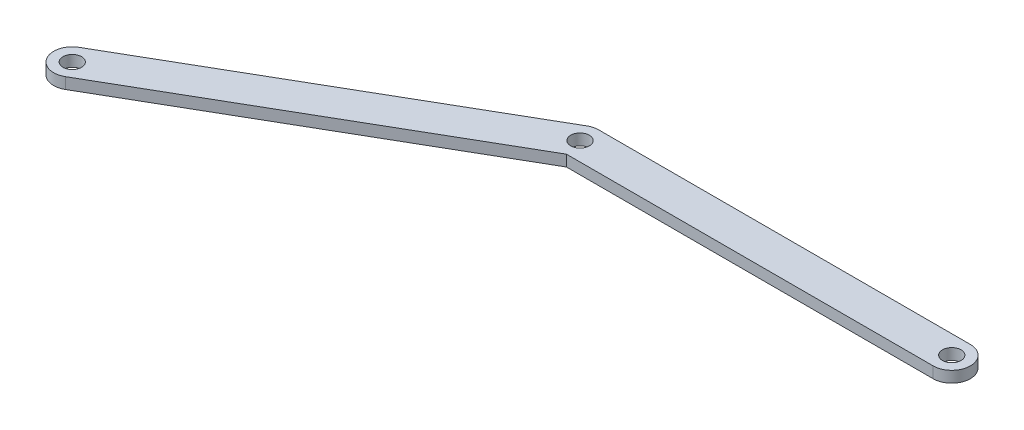
from build123d import *

# Parameters (mm, degrees)
SKETCH1_R               = 3.175
BOSS_EXTRUDE1_DEPTH     = 3.81
SKETCH2_R               = 3.175
BOSS_EXTRUDE2_DEPTH     = 3.81
CUT_EXTRUDE4_DEPTH      = 3.81
CUT_EXTRUDE4_DEPTH_BACK = 3.81
SKETCH1_2_R             = 3.175


with BuildPart() as part:
    # Sketch1 → Boss-Extrude1 (new body)
    with BuildSketch(Plane(origin=(0, 0, 0), x_dir=(1, 0, 0), z_dir=(0, 1, 0))):
        with BuildLine():
            Line((-63.5, 6.35), (63.5, 6.35))
            ThreePointArc((63.5, 6.35), (69.85, 0), (63.5, -6.35))
            Line((63.5, -6.35), (-63.5, -6.35))
            ThreePointArc((-63.5, -6.35), (-69.85, 0), (-63.5, 6.35))
        make_face()
        with Locations((-63.5, 0)):
            Circle(SKETCH1_R, mode=Mode.SUBTRACT)
        with Locations((63.5, 0)):
            Circle(SKETCH1_R, mode=Mode.SUBTRACT)
    extrude(amount=BOSS_EXTRUDE1_DEPTH)

    # Sketch2 → Boss-Extrude2 (add)
    with BuildSketch(Plane(origin=(0, 0, 0), x_dir=(1, 0, 0), z_dir=(0, 1, 0))):
        with BuildLine():
            Line((-176.660226281, -58.000738686), (-66.675, 5.499261314))
            ThreePointArc((-66.675, 5.499261314), (-58.000738686, 3.175), (-60.325, -5.499261314))
            Line((-60.325, -5.499261314), (-170.310226281, -68.999261314))
            ThreePointArc((-170.310226281, -68.999261314), (-178.984487595, -66.675), (-176.660226281, -58.000738686))
        make_face()
        with Locations((-173.485226281, -63.5)):
            Circle(SKETCH2_R, mode=Mode.SUBTRACT)
    extrude(amount=BOSS_EXTRUDE2_DEPTH)

    # Sketch1<2> → Cut-Extrude4 (cut, two sides: drawn at the far end of the back side and taken through both)
    with BuildSketch(Plane(origin=(0, 0, 0), x_dir=(1, 0, 0), z_dir=(0, 1, 0)).offset(-CUT_EXTRUDE4_DEPTH_BACK)):
        with Locations((-63.5, 0)):
            Circle(SKETCH1_2_R)
    extrude(amount=CUT_EXTRUDE4_DEPTH + CUT_EXTRUDE4_DEPTH_BACK, mode=Mode.SUBTRACT)


solid = part.part
